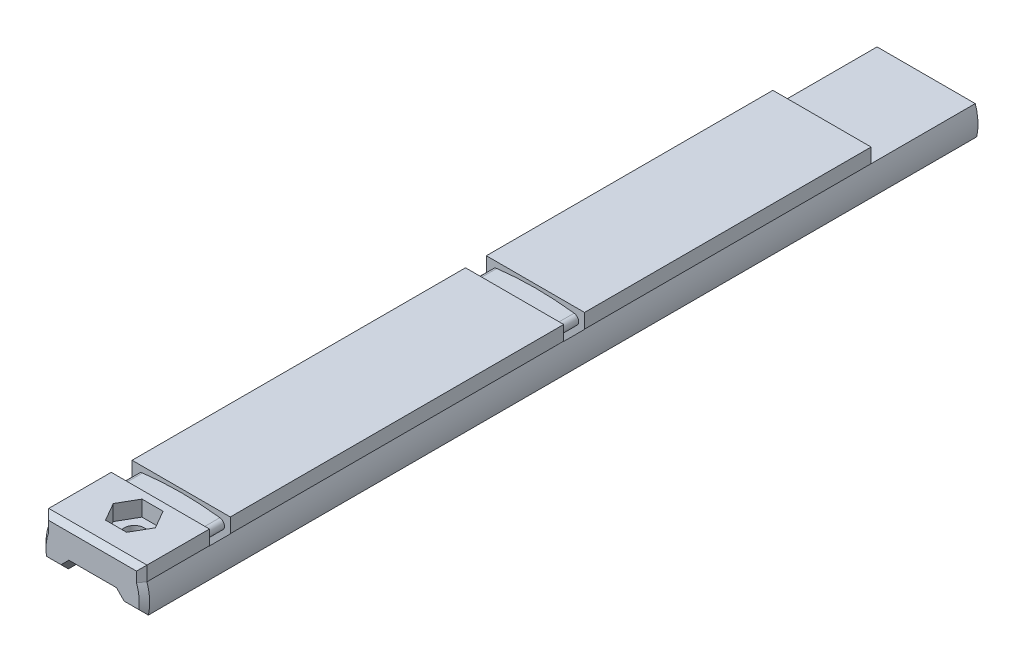
from build123d import *

# Parameters (mm, degrees)
EXTRUDE_1_DEPTH                  = 160
SKETCH_4_W                       = 18.849551718
SKETCH_4_H                       = 140
EXTRUDE_2_DEPTH                  = 2.78
CUT_EXTRUDE_2_DEPTH              = 161.420208827
CUT_EXTRUDE_2_DEPTH_BACK         = 161.420208827
SKETCH_5_R                       = 1.95
CUT_EXTRUDE_3_DEPTH              = 3
CHAMFER_1_SIZE                   = 1
SKETCH_8_W                       = 4
SKETCH_8_H                       = 1
CUT_EXTRUDE_4_DEPTH              = 161.481311685
CUT_EXTRUDE_5_DEPTH              = 4
FILLET_1_R                       = 1
PATTERN_LINEAR_1_COUNT           = 2
PATTERN_LINEAR_1_PITCH           = 68
PATTERN_LINEAR_1_COPY_1_SKETCH_W = 4
PATTERN_LINEAR_1_COPY_1_SKETCH_H = 1
PATTERN_LINEAR_1_COPY_1_DEPTH    = 161.481311685
FILLET_1_OF_PATTERN_LINEAR_1_R   = 1


with BuildPart() as part:
    # 스케치1 → 보스-돌출1 (new body)
    with BuildSketch(Plane.XY):
        with BuildLine():
            Line((-9.424775859, 3.19), (9.424775859, 3.19))
            ThreePointArc((9.424775859, 3.19), (9.936964373, 0.509155237), (9.701463807, -2.21))
            Line((9.701463807, -2.21), (5.65, -2.21))
            Line((5.65, -2.21), (4.15, -0.71))
            Line((4.15, -0.71), (-4.15, -0.71))
            Line((-4.15, -0.71), (-5.65, -2.21))
            Line((-5.65, -2.21), (-9.701463807, -2.21))
            ThreePointArc((-9.701463807, -2.21), (-9.936964373, 0.509155237), (-9.424775859, 3.19))
        make_face()
    extrude(amount=EXTRUDE_1_DEPTH)

    # 스케치4 → 보스-돌출2 (add)
    with BuildSketch(Plane(origin=(0, 3.19, 0), x_dir=(1, 0, 0), z_dir=(0, 1, 0))):
        with Locations((0, -90)):
            Rectangle(SKETCH_4_W, SKETCH_4_H)
    extrude(amount=EXTRUDE_2_DEPTH)

    # 스케치5 → 컷-돌출2 (cut, two sides: drawn at the far end of the back side and taken through both)
    with BuildSketch(Plane(origin=(0, 0, 0), x_dir=(1, 0, 0), z_dir=(0, 1, 0)).offset(-CUT_EXTRUDE_2_DEPTH_BACK)):
        with Locations(Location((0, -152, 0), (0, 0, 180))):
            Circle(SKETCH_5_R)
    extrude(amount=CUT_EXTRUDE_2_DEPTH + CUT_EXTRUDE_2_DEPTH_BACK, mode=Mode.SUBTRACT)

    # 스케치6 → 컷-돌출3 (cut)
    with BuildSketch(Plane(origin=(0, 5.97, 0), x_dir=(1, 0, 0), z_dir=(0, 1, 0))):
        Polygon((4.041451884, -152), (2.020725942, -148.5), (-2.020725942, -148.5), (-4.041451884, -152), (-2.020725942, -155.5), (2.020725942, -155.5), align=None)
    extrude(amount=-CUT_EXTRUDE_3_DEPTH, mode=Mode.SUBTRACT)

    # 모따기1
    chamfer_1_edges = [part.edges().sort_by_distance(p)[0] for p in [
        (0, -0.71, 160),
        (-4.9, -1.46, 160),
        (-7.675731904, -2.21, 160),
        (-9.936964373, 0.509155237, 160),
        (-9.424775859, 4.58, 160),
        (0, 5.97, 160),
        (9.424775859, 4.58, 160),
        (9.936964373, 0.509155237, 160),
        (7.675731904, -2.21, 160),
        (4.9, -1.46, 160),
    ]]
    chamfer(chamfer_1_edges, length=CHAMFER_1_SIZE)

    # 스케치8 → 컷-돌출4 (cut, through all)
    with BuildSketch(Plane(origin=(1.72, 1.72, 0), x_dir=(0, 0, 1), z_dir=(-0.7071067811865488, -0.7071067811865464, 0))):
        with Locations((77, -3.936538957)):
            Rectangle(SKETCH_8_W, SKETCH_8_H)
    cut_extrude_4 = extrude(amount=-CUT_EXTRUDE_4_DEPTH, mode=Mode.SUBTRACT)

    # 대칭 복사1: 컷-돌출4 across plane
    add(cut_extrude_4.mirror(Plane(origin=(0, 0, 0), x_dir=(0, 0, 1), z_dir=(1, 0, 0))), mode=Mode.SUBTRACT)

    # 스케치9 → 컷-돌출5 (cut)
    with BuildSketch(Plane.XY.offset(75)):
        with BuildLine():
            Line((-9.424775859, 4.564775859), (-13.291839, 9.783941573))
            Line((-13.291839, 9.783941573), (12.328532893, 9.783941573))
            Line((12.328532893, 9.783941573), (9.424775859, 4.564775859))
            ThreePointArc((9.424775859, 4.564775859), (0, 5.311625169), (-9.424775859, 4.564775859))
        make_face()
    cut_extrude_5 = extrude(amount=CUT_EXTRUDE_5_DEPTH, mode=Mode.SUBTRACT)

    # 필렛1
    # the kernel refuses this fillet: 1 mm, written as the material it takes off along each edge
    with BuildSketch(Plane(origin=(9.424775859, 4.564775859, 79), x_dir=(-0.7071067811865487, -0.7071067811865465, 0), z_dir=(0, 0, -1))) as fillet_1_piece_1:
        with BuildLine():
            CenterArc((2.001337163, 1), FILLET_1_R, 142.129139592, 127.870860408)
            ThreePointArc((1.211940766, 1.613883807), (0.5991659, 0.812051708), (0, 0))
            Line((0, 0), (2.001337163, 0))
        make_face()
    extrude(amount=4, mode=Mode.SUBTRACT)
    with BuildSketch(Plane(origin=(-9.424775859, 4.564775859, 79), x_dir=(0.7071067811865489, -0.7071067811865462, 0), z_dir=(0, 0, -1))) as fillet_1_piece_2:
        with BuildLine():
            CenterArc((2.001337163, -1), FILLET_1_R, 90, 127.870860408)
            ThreePointArc((1.211940766, -1.613883807), (0.5991659, -0.812051708), (0, 0))
            Line((0, 0), (2.001337163, 0))
        make_face()
    extrude(amount=4, mode=Mode.SUBTRACT)

    # 선형 패턴1: 컷-돌출4, 컷-돌출5 ×2
    with Locations(*[(0, 0, i * PATTERN_LINEAR_1_PITCH) for i in range(1, PATTERN_LINEAR_1_COUNT)]):
        add(cut_extrude_4, mode=Mode.SUBTRACT)
        add(cut_extrude_5, mode=Mode.SUBTRACT)

    # 선형 패턴1 copy 1 sketch → 선형 패턴1 copy 1 (cut, through all)
    with BuildSketch(Plane(origin=(-1.72, 1.72, 68), x_dir=(0, 0, 1), z_dir=(0.7071067811865488, -0.7071067811865464, 0))):
        with Locations((77, 3.936538957)):
            Rectangle(PATTERN_LINEAR_1_COPY_1_SKETCH_W, PATTERN_LINEAR_1_COPY_1_SKETCH_H)
    extrude(amount=-PATTERN_LINEAR_1_COPY_1_DEPTH, mode=Mode.SUBTRACT)

    # 필렛1 of 선형 패턴1
    # the kernel refuses this fillet: 1 mm, written as the material it takes off along each edge
    with BuildSketch(Plane(origin=(9.424775859, 4.564775859, 147), x_dir=(-0.7071067811865485, -0.7071067811865467, 0), z_dir=(0, 0, -1)), Plane(origin=(-9.424775859, 4.564775859, 143), x_dir=(0.707106781186548, -0.7071067811865471, 0), z_dir=(0, 0, 1))) as fillet_1_of_pattern_linear_1_piece_1:
        with BuildLine():
            CenterArc((2.001337163, 1), FILLET_1_OF_PATTERN_LINEAR_1_R, 142.129139592, 127.870860408)
            ThreePointArc((1.211940766, 1.613883807), (0.5991659, 0.812051708), (0, 0))
            Line((0, 0), (2.001337163, 0))
        make_face()
    extrude(amount=4, mode=Mode.SUBTRACT)


solid = part.part
